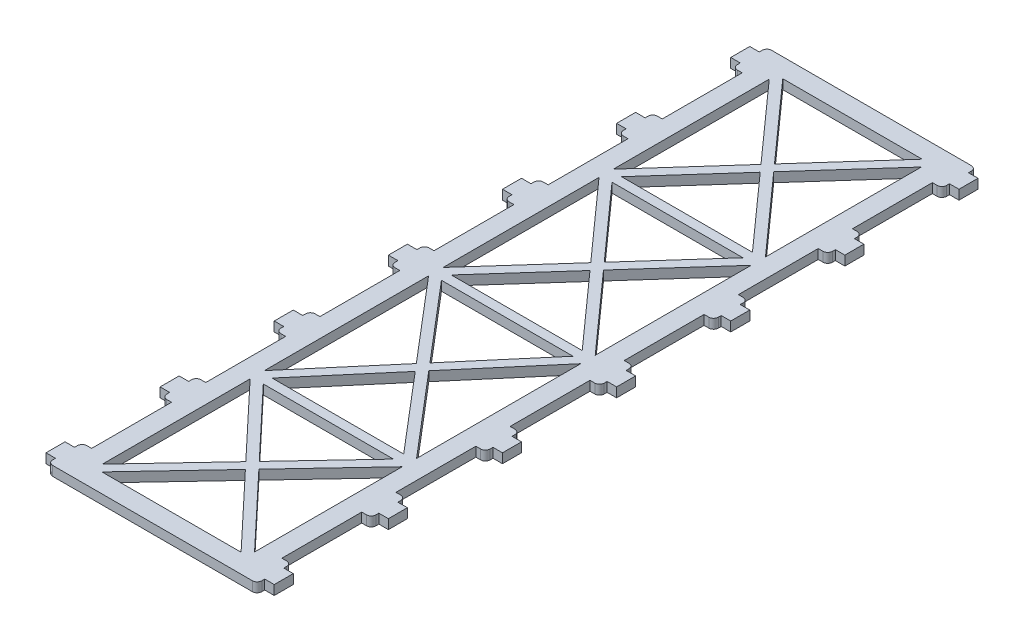
from build123d import *

# Parameters (mm, degrees)
SKETCH1_W              = 63.5
SKETCH1_H              = 240.03
BOSS_EXTRUDE1_DEPTH    = 3.175
CUT_EXTRUDE1_DEPTH     = 125.184312012
SKETCH3_W              = 11.43
SKETCH3_H              = 3.175
BOSS_EXTRUDE2_DEPTH    = 3.175
SKETCH4_W              = 6.35
SKETCH4_H              = 3.175
BOSS_EXTRUDE3_DEPTH    = 3.175
FILLET4_R              = 1.5748
FILLET6_R              = 1.5748
LPATTERN2_COUNT        = 7
LPATTERN2_PITCH        = 38.1
FILLET4_OF_LPATTERN2_R = 1.5748
FILLET6_OF_LPATTERN2_R = 1.5748
MIRROR1_DEPTH          = 3.175


# Read off the part's stored shape, not the designer's step: Mirror1
with BuildPart() as part:
    # Sketch1 → Boss-Extrude1 (new body)
    with BuildSketch(Plane(origin=(0, 0, 0), x_dir=(1, 0, 0), z_dir=(0, 1, 0))):
        Rectangle(SKETCH1_W, SKETCH1_H)
    extrude(amount=BOSS_EXTRUDE1_DEPTH)

    # Sketch2 → Cut-Extrude1 (cut, through all)
    with BuildSketch(Plane(origin=(0, 3.175, 0), x_dir=(1, 0, 0), z_dir=(0, 1, 0))):
        Polygon((-25.4, 111.282902657), (-25.4, 59.214597343), (-2.129249021, 85.24875), align=None)
        Polygon((-23.270750979, 113.665), (0, 87.630847343), (23.270750979, 113.665), align=None)
        Polygon((2.129249021, 85.24875), (25.4, 59.214597343), (25.4, 111.282902657), align=None)
        Polygon((0, 82.866652657), (-21.851756565, 58.42), (21.851756565, 58.42), align=None)
        Polygon((-21.851756565, 55.245), (0, 30.798347343), (21.851756565, 55.245), align=None)
        Polygon((-25.4, 54.450402657), (-25.4, 2.382097343), (-2.129249021, 28.41625), align=None)
        Polygon((2.129249021, 28.41625), (25.4, 2.382097343), (25.4, 54.450402657), align=None)
        Polygon((0, 26.034152657), (-21.851756565, 1.5875), (21.851756565, 1.5875), align=None)
        Polygon((-25.4, -2.450045606), (-25.4, -57.267195083), (-2.084194034, -29.858620344), align=None)
        Polygon((-21.965358439, -1.5875), (0, -27.408574738), (21.965358439, -1.5875), align=None)
        Polygon((2.084194034, -29.858620344), (25.4, -57.267195083), (25.4, -2.450045606), align=None)
        Polygon((0, -32.30866595), (-21.965358439, -58.129740689), (21.965358439, -58.129740689), align=None)
        Polygon((-21.724577783, -61.304740689), (0, -84.375455126), (21.724577783, -61.304740689), align=None)
        Polygon((-25.4, -62.032905907), (-25.4, -111.349334781), (-2.180550121, -86.691120344), align=None)
        Polygon((0, -89.006785563), (-23.219449879, -113.665), (23.219449879, -113.665), align=None)
        Polygon((25.4, -62.032905907), (2.180550121, -86.691120344), (25.4, -111.349334781), align=None)
    extrude(amount=-CUT_EXTRUDE1_DEPTH, mode=Mode.SUBTRACT)

    # Sketch3 → Boss-Extrude2 (add)
    with BuildSketch(Plane(origin=(31.75, 0, 0), x_dir=(0, 0, -1), z_dir=(1, 0, 0))):
        with Locations((-114.3, 1.5875)):
            Rectangle(SKETCH3_W, SKETCH3_H)
    boss_extrude2 = extrude(amount=BOSS_EXTRUDE2_DEPTH)

    # Sketch4 → Boss-Extrude3 (add)
    with BuildSketch(Plane(origin=(34.925, 0, 0), x_dir=(0, 0, -1), z_dir=(1, 0, 0))):
        with Locations((-114.3, 1.5875)):
            Rectangle(SKETCH4_W, SKETCH4_H)
    boss_extrude3 = extrude(amount=BOSS_EXTRUDE3_DEPTH)

    # Fillet4
    fillet4_edges = [part.edges().sort_by_distance(p)[0] for p in [
        (34.925, 1.5875, 108.585),
    ]]
    fillet(fillet4_edges, radius=FILLET4_R)

    # Fillet6
    fillet6_edges = [part.edges().sort_by_distance(p)[0] for p in [
        (34.925, 1.5875, 120.015),
    ]]
    fillet(fillet6_edges, radius=FILLET6_R)

    # LPattern2: Boss-Extrude2, Boss-Extrude3 ×7
    with Locations(*[(0, 0, -i * LPATTERN2_PITCH) for i in range(1, LPATTERN2_COUNT)]):
        add(boss_extrude2)
        add(boss_extrude3)

    # Fillet4 of LPattern2
    fillet4_of_lpattern2_edges = [part.edges().sort_by_distance(p)[0] for p in [
        (34.925, 1.5875, 70.485),
        (34.925, 1.5875, 32.385),
        (34.925, 1.5875, -5.715),
        (34.925, 1.5875, -43.815),
        (34.925, 1.5875, -81.915),
        (34.925, 1.5875, -120.015),
    ]]
    fillet(fillet4_of_lpattern2_edges, radius=FILLET4_OF_LPATTERN2_R)

    # Fillet6 of LPattern2
    fillet6_of_lpattern2_edges = [part.edges().sort_by_distance(p)[0] for p in [
        (34.925, 1.5875, 81.915),
        (34.925, 1.5875, 43.815),
        (34.925, 1.5875, 5.715),
        (34.925, 1.5875, -32.385),
        (34.925, 1.5875, -70.485),
        (34.925, 1.5875, -108.585),
    ]]
    fillet(fillet6_of_lpattern2_edges, radius=FILLET6_OF_LPATTERN2_R)

    # Mirror1 outline → Mirror1 (add)
    with BuildSketch(Plane(origin=(0, 0, 0), x_dir=(1, 0, 0), z_dir=(0, 1, 0))):
        with BuildLine():
            Line((-31.75, -120.015), (-31.75, -108.585))
            Line((-31.75, -108.585), (-33.3502, -108.585))
            ThreePointArc((-33.3502, -108.585), (-34.463751759, -109.046248241), (-34.925, -110.1598))
            Line((-34.925, -110.1598), (-34.925, -111.125))
            Line((-34.925, -111.125), (-38.1, -111.125))
            Line((-38.1, -111.125), (-38.1, -117.475))
            Line((-38.1, -117.475), (-34.925, -117.475))
            Line((-34.925, -117.475), (-34.925, -118.4402))
            ThreePointArc((-34.925, -118.4402), (-34.463751759, -119.553751759), (-33.3502, -120.015))
            Line((-33.3502, -120.015), (-31.75, -120.015))
        make_face()
        with BuildLine():
            Line((-31.75, -81.915), (-31.75, -70.485))
            Line((-31.75, -70.485), (-33.3502, -70.485))
            ThreePointArc((-33.3502, -70.485), (-34.463751759, -70.946248241), (-34.925, -72.0598))
            Line((-34.925, -72.0598), (-34.925, -73.025))
            Line((-34.925, -73.025), (-38.1, -73.025))
            Line((-38.1, -73.025), (-38.1, -79.375))
            Line((-38.1, -79.375), (-34.925, -79.375))
            Line((-34.925, -79.375), (-34.925, -80.3402))
            ThreePointArc((-34.925, -80.3402), (-34.463751759, -81.453751759), (-33.3502, -81.915))
            Line((-33.3502, -81.915), (-31.75, -81.915))
        make_face()
        with BuildLine():
            Line((-31.75, -43.815), (-31.75, -32.385))
            Line((-31.75, -32.385), (-33.3502, -32.385))
            ThreePointArc((-33.3502, -32.385), (-34.463751759, -32.846248241), (-34.925, -33.9598))
            Line((-34.925, -33.9598), (-34.925, -34.925))
            Line((-34.925, -34.925), (-38.1, -34.925))
            Line((-38.1, -34.925), (-38.1, -41.275))
            Line((-38.1, -41.275), (-34.925, -41.275))
            Line((-34.925, -41.275), (-34.925, -42.2402))
            ThreePointArc((-34.925, -42.2402), (-34.463751759, -43.353751759), (-33.3502, -43.815))
            Line((-33.3502, -43.815), (-31.75, -43.815))
        make_face()
        with BuildLine():
            Line((-31.75, -5.715), (-31.75, 5.715))
            Line((-31.75, 5.715), (-33.3502, 5.715))
            ThreePointArc((-33.3502, 5.715), (-34.463751759, 5.253751759), (-34.925, 4.1402))
            Line((-34.925, 4.1402), (-34.925, 3.175))
            Line((-34.925, 3.175), (-38.1, 3.175))
            Line((-38.1, 3.175), (-38.1, -3.175))
            Line((-38.1, -3.175), (-34.925, -3.175))
            Line((-34.925, -3.175), (-34.925, -4.1402))
            ThreePointArc((-34.925, -4.1402), (-34.463751759, -5.253751759), (-33.3502, -5.715))
            Line((-33.3502, -5.715), (-31.75, -5.715))
        make_face()
        with BuildLine():
            Line((-31.75, 32.385), (-31.75, 43.815))
            Line((-31.75, 43.815), (-33.3502, 43.815))
            ThreePointArc((-33.3502, 43.815), (-34.463751759, 43.353751759), (-34.925, 42.2402))
            Line((-34.925, 42.2402), (-34.925, 41.275))
            Line((-34.925, 41.275), (-38.1, 41.275))
            Line((-38.1, 41.275), (-38.1, 34.925))
            Line((-38.1, 34.925), (-34.925, 34.925))
            Line((-34.925, 34.925), (-34.925, 33.9598))
            ThreePointArc((-34.925, 33.9598), (-34.463751759, 32.846248241), (-33.3502, 32.385))
            Line((-33.3502, 32.385), (-31.75, 32.385))
        make_face()
        with BuildLine():
            Line((-31.75, 70.485), (-31.75, 81.915))
            Line((-31.75, 81.915), (-33.3502, 81.915))
            ThreePointArc((-33.3502, 81.915), (-34.463751759, 81.453751759), (-34.925, 80.3402))
            Line((-34.925, 80.3402), (-34.925, 79.375))
            Line((-34.925, 79.375), (-38.1, 79.375))
            Line((-38.1, 79.375), (-38.1, 73.025))
            Line((-38.1, 73.025), (-34.925, 73.025))
            Line((-34.925, 73.025), (-34.925, 72.0598))
            ThreePointArc((-34.925, 72.0598), (-34.463751759, 70.946248241), (-33.3502, 70.485))
            Line((-33.3502, 70.485), (-31.75, 70.485))
        make_face()
        with BuildLine():
            ThreePointArc((-33.3502, 120.015), (-34.463751759, 119.553751759), (-34.925, 118.4402))
            Line((-34.925, 118.4402), (-34.925, 117.475))
            Line((-34.925, 117.475), (-38.1, 117.475))
            Line((-38.1, 117.475), (-38.1, 111.125))
            Line((-38.1, 111.125), (-34.925, 111.125))
            Line((-34.925, 111.125), (-34.925, 110.1598))
            ThreePointArc((-34.925, 110.1598), (-34.463751759, 109.046248241), (-33.3502, 108.585))
            Line((-33.3502, 108.585), (-31.75, 108.585))
            Line((-31.75, 108.585), (-31.75, 120.015))
            Line((-31.75, 120.015), (-33.3502, 120.015))
        make_face()
    extrude(amount=MIRROR1_DEPTH)


solid = part.part
